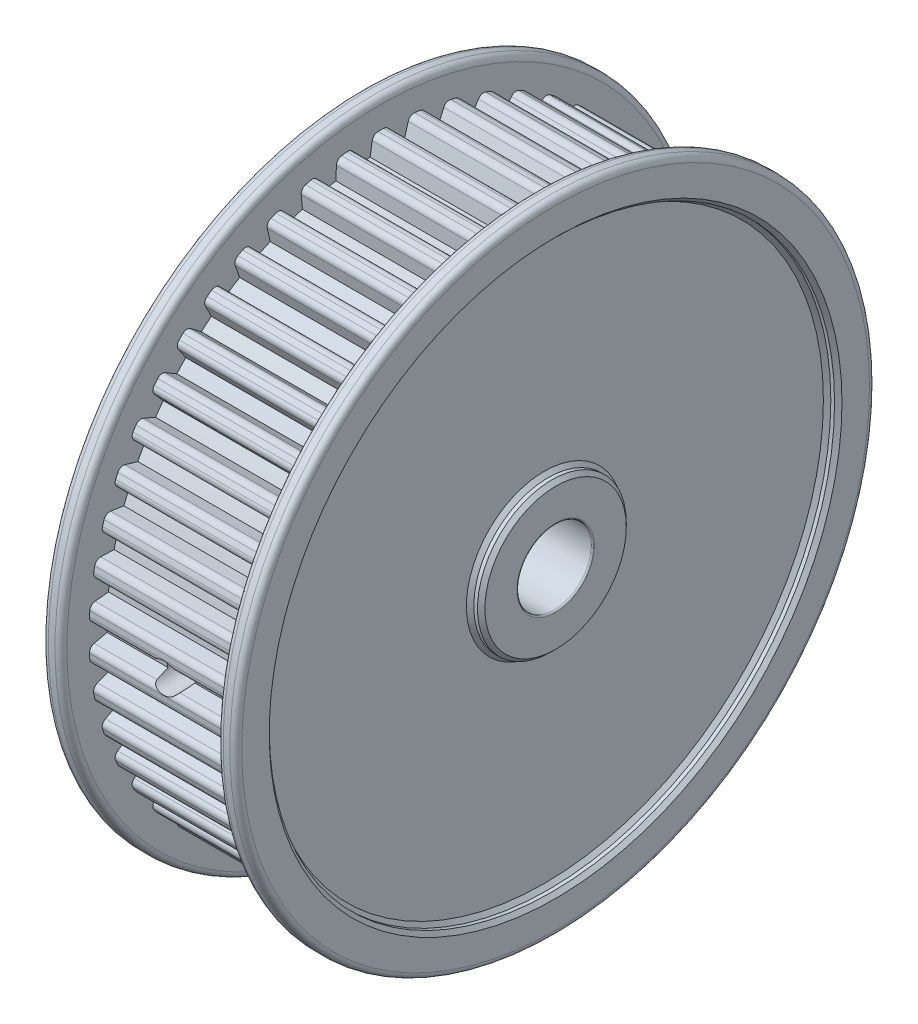
from build123d import *

# Parameters (mm, degrees)
SKETCH_1_R               = 43
EXTRUDE_1_DEPTH          = 2.5
EXTRUDE_2_DEPTH          = 21
SKETCH_3_R               = 43
EXTRUDE_3_DEPTH          = 2.5
SKETCH_4_R               = 5
CUT_EXTRUDE_1_DEPTH      = 67.136223055
SKETCH_5_R               = 38
SKETCH_5_R_2             = 10
CUT_EXTRUDE_2_DEPTH      = 1.5
CUT_EXTRUDE_START        = -1.5
SKETCH_6_R               = 38
SKETCH_6_R_2             = 10
CUT_EXTRUDE_3_DEPTH      = 1.5
FILLET_1_R               = 0.8
CHAMFER_1_SIZE           = 0.5
CHAMFER_2_SIZE           = 0.5
FILLET_2_R               = 0.2
CUT_EXTRUDE_4_DEPTH      = 67.136223185
CUT_EXTRUDE_4_DEPTH_BACK = 67.136223185
SKETCH_7_R               = 2


with BuildPart() as part:
    # 草图1 → 凸台-拉伸1 (new body)
    with BuildSketch(Plane(origin=(0, 0, 0), x_dir=(0, 0, -1), z_dir=(1, 0, 0))):
        Circle(SKETCH_1_R)
    extrude(amount=EXTRUDE_1_DEPTH)

    # 草图2 → 凸台-拉伸2 (add)
    with BuildSketch(Plane(origin=(2.5, 0, 0), x_dir=(0, 0, -1), z_dir=(1, 0, 0))):
        with BuildLine():
            Line((1.14758971, 38.545549929), (1.433241246, 36.772079347))
            ThreePointArc((1.433241246, 36.772079347), (2.310691119, 36.727383606), (3.186823898, 36.661753278))
            Line((3.186823898, 36.661753278), (3.69249779, 38.385437884))
            ThreePointArc((3.69249779, 38.385437884), (4.018691974, 38.827406571), (4.553017122, 38.954825569))
            ThreePointArc((4.553017122, 38.954825569), (4.91556942, 38.910738586), (5.277695458, 38.863277405))
            ThreePointArc((5.277695458, 38.863277405), (5.763545983, 38.606980248), (5.969579034, 38.097775626))
            Line((5.969579034, 38.097775626), (6.030703321, 36.302487759))
            ThreePointArc((6.030703321, 36.302487759), (6.895632377, 36.148170827), (7.756630927, 35.973249459))
            Line((7.756630927, 35.973249459), (8.474352394, 37.619964553))
            ThreePointArc((8.474352394, 37.619964553), (8.853367804, 38.017565213), (9.399449474, 38.077010775))
            ThreePointArc((9.399449474, 38.077010775), (9.753617375, 37.987831579), (10.106939477, 37.895358217))
            ThreePointArc((10.106939477, 37.895358217), (10.556836374, 37.580188823), (10.697424531, 37.049176642))
            Line((10.697424531, 37.049176642), (10.533057601, 35.260384252))
            ThreePointArc((10.533057601, 35.260384252), (11.371825393, 34.9988798), (12.204111251, 34.717426007))
            Line((12.204111251, 34.717426007), (13.122561398, 36.261201908))
            ThreePointArc((13.122561398, 36.261201908), (13.548420735, 36.608164141), (14.097646892, 36.598698776))
            ThreePointArc((14.097646892, 36.598698776), (14.437844956, 36.465833777), (14.776791023, 36.329806593))
            ThreePointArc((14.776791023, 36.329806593), (15.183639149, 35.96073537), (15.256565253, 35.416290011))
            Line((15.256565253, 35.416290011), (14.869299271, 33.662203422))
            ThreePointArc((14.869299271, 33.662203422), (15.66867793, 33.297635531), (16.459125452, 32.914088008))
            Line((16.459125452, 32.914088008), (17.56381977, 34.330578448))
            ThreePointArc((17.56381977, 34.330578448), (18.029806977, 34.621430452), (18.573515998, 34.543203434))
            ThreePointArc((18.573515998, 34.543203434), (18.894379098, 34.368747991), (19.213603747, 34.191312216))
            ThreePointArc((19.213603747, 34.191312216), (19.570986865, 33.774159639), (19.575100827, 33.22486733))
            Line((19.575100827, 33.22486733), (18.971043208, 31.533149535))
            ThreePointArc((18.971043208, 31.533149535), (19.718426055, 31.071267658), (20.454569411, 30.591675178))
            Line((20.454569411, 30.591675178), (21.728086212, 31.858541257))
            ThreePointArc((21.728086212, 31.858541257), (22.226852393, 32.088696123), (22.75646966, 31.942941139))
            ThreePointArc((22.75646966, 31.942941139), (23.052937595, 31.729646519), (23.347406463, 31.513600421))
            ThreePointArc((23.347406463, 31.513600421), (23.649688426, 31.054945235), (23.584925368, 30.509468643))
            Line((23.584925368, 30.509468643), (22.773602462, 28.906799043))
            ThreePointArc((22.773602462, 28.906799043), (23.457202823, 28.354887334), (24.127432592, 27.786813357))
            Line((24.127432592, 27.786813357), (25.549687755, 28.88407584))
            ThreePointArc((25.549687755, 28.88407584), (26.073367069, 29.049903887), (26.580540203, 28.83891958))
            ThreePointArc((26.580540203, 28.83891958), (26.847937495, 28.590149567), (27.113006631, 28.338900321))
            ThreePointArc((27.113006631, 28.338900321), (27.355420274, 27.845975792), (27.222801546, 27.312917411))
            Line((27.222801546, 27.312917411), (26.2170084, 25.824571062))
            ThreePointArc((26.2170084, 25.824571062), (26.826045489, 25.191333498), (27.419791748, 24.543736889))
            Line((27.419791748, 24.543736889), (28.968355459, 25.454091291))
            ThreePointArc((28.968355459, 25.454091291), (29.508689171, 25.552977314), (29.985419747, 25.280091032))
            ThreePointArc((29.985419747, 25.280091032), (30.219529382, 24.999768878), (30.451018488, 24.717278835))
            ThreePointArc((30.451018488, 24.717278835), (30.629740802, 24.197858678), (30.431357882, 23.685625154))
            Line((30.431357882, 23.685625154), (29.246956455, 22.335074168))
            ThreePointArc((29.246956455, 22.335074168), (29.771825393, 21.630497284), (30.279724408, 20.91359103))
            Line((30.279724408, 20.91359103), (31.930174893, 21.622680518))
            ThreePointArc((31.930174893, 21.622680518), (32.478641617, 21.653065023), (32.91741131, 21.322580346))
            ThreePointArc((32.91741131, 21.322580346), (33.114541238, 21.015126899), (33.308799594, 20.705851096))
            ThreePointArc((33.308799594, 20.705851096), (33.421012021, 20.168126876), (33.159993525, 19.68479644))
            Line((33.159993525, 19.68479644), (31.815662535, 18.493339813))
            ThreePointArc((31.815662535, 18.493339813), (32.248085826, 17.728535207), (32.662127726, 16.953625346))
            Line((32.662127726, 16.953625346), (34.388436395, 17.450267156))
            ThreePointArc((34.388436395, 17.450267156), (34.936386483, 17.411670963), (35.330275633, 17.028799832))
            ThreePointArc((35.330275633, 17.028799832), (35.487316998, 16.699063815), (35.641281032, 16.367879717))
            ThreePointArc((35.641281032, 16.367879717), (35.685213915, 15.820331667), (35.365676262, 15.373526727))
            Line((35.365676262, 15.373526727), (33.882616611, 14.359954441))
            ThreePointArc((33.882616611, 14.359954441), (34.215774681, 13.546983539), (34.529429779, 12.726290864))
            Line((34.529429779, 12.726290864), (36.304371711, 13.002652657))
            ThreePointArc((36.304371711, 13.002652657), (36.843163664, 12.895684449), (37.185960403, 12.466464971))
            ThreePointArc((37.185960403, 12.466464971), (37.300436569, 12.119646519), (37.411678177, 11.771777096))
            ThreePointArc((37.411678177, 11.771777096), (37.386638668, 11.223040376), (37.013621157, 10.819807314))
            Line((37.013621157, 10.819807314), (35.415221583, 10.00010401))
            ThreePointArc((35.415221583, 10.00010401), (35.64386033, 9.151787848), (35.852182097, 8.298255172))
            Line((35.852182097, 8.298255172), (37.647765399, 8.349978558))
            ThreePointArc((37.647765399, 8.349978558), (38.168902145, 8.176325289), (38.455200365, 7.70752651))
            ThreePointArc((38.455200365, 7.70752651), (38.525305974, 7.349095158), (38.592070808, 6.990026519))
            ThreePointArc((38.592070808, 6.990026519), (38.498453796, 6.448755034), (38.077839136, 6.095453076))
            Line((38.077839136, 6.095453076), (36.389307355, 5.482545965))
            ThreePointArc((36.389307355, 5.482545965), (36.509821008, 4.612262995), (36.609524086, 3.739351039))
            Line((36.609524086, 3.739351039), (38.397431337, 3.565620309))
            ThreePointArc((38.397431337, 3.565620309), (38.892694238, 3.328020595), (39.117978844, 2.827035753))
            ThreePointArc((39.117978844, 2.827035753), (39.142608289, 2.462644176), (39.163843429, 2.098039048))
            ThreePointArc((39.163843429, 2.098039048), (39.00312531, 1.572768973), (38.541546845, 1.274969902))
            Line((38.541546845, 1.274969902), (36.789512011, 0.878524894))
            ThreePointArc((36.789512011, 0.878524894), (36.8, 0), (36.789512011, -0.878524894))
            Line((36.789512011, -0.878524894), (38.541546845, -1.274969902))
            ThreePointArc((38.541546845, -1.274969902), (39.00312531, -1.572768973), (39.163843429, -2.098039048))
            ThreePointArc((39.163843429, -2.098039048), (39.142608289, -2.462644176), (39.117978844, -2.827035753))
            ThreePointArc((39.117978844, -2.827035753), (38.892694238, -3.328020595), (38.397431337, -3.565620309))
            Line((38.397431337, -3.565620309), (36.609524086, -3.739351039))
            ThreePointArc((36.609524086, -3.739351039), (36.509821008, -4.612262995), (36.389307355, -5.482545965))
            Line((36.389307355, -5.482545965), (38.077839136, -6.095453076))
            ThreePointArc((38.077839136, -6.095453076), (38.498453796, -6.448755034), (38.592070808, -6.990026519))
            ThreePointArc((38.592070808, -6.990026519), (38.525305974, -7.349095158), (38.455200365, -7.70752651))
            ThreePointArc((38.455200365, -7.70752651), (38.168902145, -8.176325289), (37.647765399, -8.349978558))
            Line((37.647765399, -8.349978558), (35.852182097, -8.298255172))
            ThreePointArc((35.852182097, -8.298255172), (35.64386033, -9.151787848), (35.415221583, -10.00010401))
            Line((35.415221583, -10.00010401), (37.013621157, -10.819807314))
            ThreePointArc((37.013621157, -10.819807314), (37.386638668, -11.223040376), (37.411678177, -11.771777096))
            ThreePointArc((37.411678177, -11.771777096), (37.300436569, -12.119646519), (37.185960403, -12.466464971))
            ThreePointArc((37.185960403, -12.466464971), (36.843163664, -12.895684449), (36.304371711, -13.002652657))
            Line((36.304371711, -13.002652657), (34.529429779, -12.726290864))
            ThreePointArc((34.529429779, -12.726290864), (34.215774681, -13.546983539), (33.882616611, -14.359954441))
            Line((33.882616611, -14.359954441), (35.365676262, -15.373526727))
            ThreePointArc((35.365676262, -15.373526727), (35.685213915, -15.820331667), (35.641281032, -16.367879717))
            ThreePointArc((35.641281032, -16.367879717), (35.487316998, -16.699063815), (35.330275633, -17.028799832))
            ThreePointArc((35.330275633, -17.028799832), (34.936386483, -17.411670963), (34.388436395, -17.450267156))
            Line((34.388436395, -17.450267156), (32.662127726, -16.953625346))
            ThreePointArc((32.662127726, -16.953625346), (32.248085826, -17.728535207), (31.815662535, -18.493339813))
            Line((31.815662535, -18.493339813), (33.159993525, -19.68479644))
            ThreePointArc((33.159993525, -19.68479644), (33.421012021, -20.168126876), (33.308799594, -20.705851096))
            ThreePointArc((33.308799594, -20.705851096), (33.114541238, -21.015126899), (32.91741131, -21.322580346))
            ThreePointArc((32.91741131, -21.322580346), (32.478641617, -21.653065023), (31.930174893, -21.622680518))
            Line((31.930174893, -21.622680518), (30.279724408, -20.91359103))
            ThreePointArc((30.279724408, -20.91359103), (29.771825393, -21.630497284), (29.246956455, -22.335074168))
            Line((29.246956455, -22.335074168), (30.431357882, -23.685625154))
            ThreePointArc((30.431357882, -23.685625154), (30.629740802, -24.197858678), (30.451018488, -24.717278835))
            ThreePointArc((30.451018488, -24.717278835), (30.219529382, -24.999768878), (29.985419747, -25.280091032))
            ThreePointArc((29.985419747, -25.280091032), (29.508689171, -25.552977314), (28.968355459, -25.454091291))
            Line((28.968355459, -25.454091291), (27.419791748, -24.543736889))
            ThreePointArc((27.419791748, -24.543736889), (26.826045489, -25.191333498), (26.2170084, -25.824571062))
            Line((26.2170084, -25.824571062), (27.222801546, -27.312917411))
            ThreePointArc((27.222801546, -27.312917411), (27.355420274, -27.845975792), (27.113006631, -28.338900321))
            ThreePointArc((27.113006631, -28.338900321), (26.847937495, -28.590149567), (26.580540203, -28.83891958))
            ThreePointArc((26.580540203, -28.83891958), (26.073367069, -29.049903887), (25.549687755, -28.88407584))
            Line((25.549687755, -28.88407584), (24.127432592, -27.786813357))
            ThreePointArc((24.127432592, -27.786813357), (23.457202823, -28.354887334), (22.773602462, -28.906799043))
            Line((22.773602462, -28.906799043), (23.584925368, -30.509468643))
            ThreePointArc((23.584925368, -30.509468643), (23.649688426, -31.054945235), (23.347406463, -31.513600421))
            ThreePointArc((23.347406463, -31.513600421), (23.052937595, -31.729646519), (22.75646966, -31.942941139))
            ThreePointArc((22.75646966, -31.942941139), (22.226852393, -32.088696123), (21.728086212, -31.858541257))
            Line((21.728086212, -31.858541257), (20.454569411, -30.591675178))
            ThreePointArc((20.454569411, -30.591675178), (19.718426055, -31.071267658), (18.971043208, -31.533149535))
            Line((18.971043208, -31.533149535), (19.575100827, -33.22486733))
            ThreePointArc((19.575100827, -33.22486733), (19.570986865, -33.774159639), (19.213603747, -34.191312216))
            ThreePointArc((19.213603747, -34.191312216), (18.894379098, -34.368747991), (18.573515998, -34.543203434))
            ThreePointArc((18.573515998, -34.543203434), (18.029806977, -34.621430452), (17.56381977, -34.330578448))
            Line((17.56381977, -34.330578448), (16.459125452, -32.914088008))
            ThreePointArc((16.459125452, -32.914088008), (15.66867793, -33.297635531), (14.869299271, -33.662203422))
            Line((14.869299271, -33.662203422), (15.256565253, -35.416290011))
            ThreePointArc((15.256565253, -35.416290011), (15.183639149, -35.96073537), (14.776791023, -36.329806593))
            ThreePointArc((14.776791023, -36.329806593), (14.437844956, -36.465833777), (14.097646892, -36.598698776))
            ThreePointArc((14.097646892, -36.598698776), (13.548420735, -36.608164141), (13.122561398, -36.261201908))
            Line((13.122561398, -36.261201908), (12.204111251, -34.717426007))
            ThreePointArc((12.204111251, -34.717426007), (11.371825393, -34.9988798), (10.533057601, -35.260384252))
            Line((10.533057601, -35.260384252), (10.697424531, -37.049176642))
            ThreePointArc((10.697424531, -37.049176642), (10.556836374, -37.580188823), (10.106939477, -37.895358217))
            ThreePointArc((10.106939477, -37.895358217), (9.753617375, -37.987831579), (9.399449474, -38.077010775))
            ThreePointArc((9.399449474, -38.077010775), (8.853367804, -38.017565213), (8.474352394, -37.619964553))
            Line((8.474352394, -37.619964553), (7.756630927, -35.973249459))
            ThreePointArc((7.756630927, -35.973249459), (6.895632377, -36.148170827), (6.030703321, -36.302487759))
            Line((6.030703321, -36.302487759), (5.969579034, -38.097775626))
            ThreePointArc((5.969579034, -38.097775626), (5.763545983, -38.606980248), (5.277695458, -38.863277405))
            ThreePointArc((5.277695458, -38.863277405), (4.91556942, -38.910738586), (4.553017122, -38.954825569))
            ThreePointArc((4.553017122, -38.954825569), (4.018691974, -38.827406571), (3.69249779, -38.385437884))
            Line((3.69249779, -38.385437884), (3.186823898, -36.661753278))
            ThreePointArc((3.186823898, -36.661753278), (2.310691119, -36.727383606), (1.433241246, -36.772079347))
            Line((1.433241246, -36.772079347), (1.14758971, -38.545549929))
            ThreePointArc((1.14758971, -38.545549929), (0.879361029, -39.024916532), (0.365219029, -39.218299492))
            ThreePointArc((0.365219029, -39.218299492), (0, -39.22), (-0.365219029, -39.218299492))
            ThreePointArc((-0.365219029, -39.218299492), (-0.879361029, -39.024916532), (-1.14758971, -38.545549929))
            Line((-1.14758971, -38.545549929), (-1.433241246, -36.772079347))
            ThreePointArc((-1.433241246, -36.772079347), (-2.310691119, -36.727383606), (-3.186823898, -36.661753278))
            Line((-3.186823898, -36.661753278), (-3.69249779, -38.385437884))
            ThreePointArc((-3.69249779, -38.385437884), (-4.018691974, -38.827406571), (-4.553017122, -38.954825569))
            ThreePointArc((-4.553017122, -38.954825569), (-4.91556942, -38.910738586), (-5.277695458, -38.863277405))
            ThreePointArc((-5.277695458, -38.863277405), (-5.763545983, -38.606980248), (-5.969579034, -38.097775626))
            Line((-5.969579034, -38.097775626), (-6.030703321, -36.302487759))
            ThreePointArc((-6.030703321, -36.302487759), (-6.895632377, -36.148170827), (-7.756630927, -35.973249459))
            Line((-7.756630927, -35.973249459), (-8.474352394, -37.619964553))
            ThreePointArc((-8.474352394, -37.619964553), (-8.853367804, -38.017565213), (-9.399449474, -38.077010775))
            ThreePointArc((-9.399449474, -38.077010775), (-9.753617375, -37.987831579), (-10.106939477, -37.895358217))
            ThreePointArc((-10.106939477, -37.895358217), (-10.556836374, -37.580188823), (-10.697424531, -37.049176642))
            Line((-10.697424531, -37.049176642), (-10.533057601, -35.260384252))
            ThreePointArc((-10.533057601, -35.260384252), (-11.371825393, -34.9988798), (-12.204111251, -34.717426007))
            Line((-12.204111251, -34.717426007), (-13.122561398, -36.261201908))
            ThreePointArc((-13.122561398, -36.261201908), (-13.548420735, -36.608164141), (-14.097646892, -36.598698776))
            ThreePointArc((-14.097646892, -36.598698776), (-14.437844956, -36.465833777), (-14.776791023, -36.329806593))
            ThreePointArc((-14.776791023, -36.329806593), (-15.183639149, -35.96073537), (-15.256565253, -35.416290011))
            Line((-15.256565253, -35.416290011), (-14.869299271, -33.662203422))
            ThreePointArc((-14.869299271, -33.662203422), (-15.66867793, -33.297635531), (-16.459125452, -32.914088008))
            Line((-16.459125452, -32.914088008), (-17.56381977, -34.330578448))
            ThreePointArc((-17.56381977, -34.330578448), (-18.029806977, -34.621430452), (-18.573515998, -34.543203434))
            ThreePointArc((-18.573515998, -34.543203434), (-18.894379098, -34.368747991), (-19.213603747, -34.191312216))
            ThreePointArc((-19.213603747, -34.191312216), (-19.570986865, -33.774159639), (-19.575100827, -33.22486733))
            Line((-19.575100827, -33.22486733), (-18.971043208, -31.533149535))
            ThreePointArc((-18.971043208, -31.533149535), (-19.718426055, -31.071267658), (-20.454569411, -30.591675178))
            Line((-20.454569411, -30.591675178), (-21.728086212, -31.858541257))
            ThreePointArc((-21.728086212, -31.858541257), (-22.226852393, -32.088696123), (-22.75646966, -31.942941139))
            ThreePointArc((-22.75646966, -31.942941139), (-23.052937595, -31.729646519), (-23.347406463, -31.513600421))
            ThreePointArc((-23.347406463, -31.513600421), (-23.649688426, -31.054945235), (-23.584925368, -30.509468643))
            Line((-23.584925368, -30.509468643), (-22.773602462, -28.906799043))
            ThreePointArc((-22.773602462, -28.906799043), (-23.457202823, -28.354887334), (-24.127432592, -27.786813357))
            Line((-24.127432592, -27.786813357), (-25.549687755, -28.88407584))
            ThreePointArc((-25.549687755, -28.88407584), (-26.073367069, -29.049903887), (-26.580540203, -28.83891958))
            ThreePointArc((-26.580540203, -28.83891958), (-26.847937495, -28.590149567), (-27.113006631, -28.338900321))
            ThreePointArc((-27.113006631, -28.338900321), (-27.355420274, -27.845975792), (-27.222801546, -27.312917411))
            Line((-27.222801546, -27.312917411), (-26.2170084, -25.824571062))
            ThreePointArc((-26.2170084, -25.824571062), (-26.826045489, -25.191333498), (-27.419791748, -24.543736889))
            Line((-27.419791748, -24.543736889), (-28.968355459, -25.454091291))
            ThreePointArc((-28.968355459, -25.454091291), (-29.508689171, -25.552977314), (-29.985419747, -25.280091032))
            ThreePointArc((-29.985419747, -25.280091032), (-30.219529382, -24.999768878), (-30.451018488, -24.717278835))
            ThreePointArc((-30.451018488, -24.717278835), (-30.629740802, -24.197858678), (-30.431357882, -23.685625154))
            Line((-30.431357882, -23.685625154), (-29.246956455, -22.335074168))
            ThreePointArc((-29.246956455, -22.335074168), (-29.771825393, -21.630497284), (-30.279724408, -20.91359103))
            Line((-30.279724408, -20.91359103), (-31.930174893, -21.622680518))
            ThreePointArc((-31.930174893, -21.622680518), (-32.478641617, -21.653065023), (-32.91741131, -21.322580346))
            ThreePointArc((-32.91741131, -21.322580346), (-33.114541238, -21.015126899), (-33.308799594, -20.705851096))
            ThreePointArc((-33.308799594, -20.705851096), (-33.421012021, -20.168126876), (-33.159993525, -19.68479644))
            Line((-33.159993525, -19.68479644), (-31.815662535, -18.493339813))
            ThreePointArc((-31.815662535, -18.493339813), (-32.248085826, -17.728535207), (-32.662127726, -16.953625346))
            Line((-32.662127726, -16.953625346), (-34.388436395, -17.450267156))
            ThreePointArc((-34.388436395, -17.450267156), (-34.936386483, -17.411670963), (-35.330275633, -17.028799832))
            ThreePointArc((-35.330275633, -17.028799832), (-35.487316998, -16.699063815), (-35.641281032, -16.367879717))
            ThreePointArc((-35.641281032, -16.367879717), (-35.685213915, -15.820331667), (-35.365676262, -15.373526727))
            Line((-35.365676262, -15.373526727), (-33.882616611, -14.359954441))
            ThreePointArc((-33.882616611, -14.359954441), (-34.215774681, -13.546983539), (-34.529429779, -12.726290864))
            Line((-34.529429779, -12.726290864), (-36.304371711, -13.002652657))
            ThreePointArc((-36.304371711, -13.002652657), (-36.843163664, -12.895684449), (-37.185960403, -12.466464971))
            ThreePointArc((-37.185960403, -12.466464971), (-37.300436569, -12.119646519), (-37.411678177, -11.771777096))
            ThreePointArc((-37.411678177, -11.771777096), (-37.386638668, -11.223040376), (-37.013621157, -10.819807314))
            Line((-37.013621157, -10.819807314), (-35.415221583, -10.00010401))
            ThreePointArc((-35.415221583, -10.00010401), (-35.64386033, -9.151787848), (-35.852182097, -8.298255172))
            Line((-35.852182097, -8.298255172), (-37.647765399, -8.349978558))
            ThreePointArc((-37.647765399, -8.349978558), (-38.168902145, -8.176325289), (-38.455200365, -7.70752651))
            ThreePointArc((-38.455200365, -7.70752651), (-38.525305974, -7.349095158), (-38.592070808, -6.990026519))
            ThreePointArc((-38.592070808, -6.990026519), (-38.498453796, -6.448755034), (-38.077839136, -6.095453076))
            Line((-38.077839136, -6.095453076), (-36.389307355, -5.482545965))
            ThreePointArc((-36.389307355, -5.482545965), (-36.509821008, -4.612262995), (-36.609524086, -3.739351039))
            Line((-36.609524086, -3.739351039), (-38.397431337, -3.565620309))
            ThreePointArc((-38.397431337, -3.565620309), (-38.892694238, -3.328020595), (-39.117978844, -2.827035753))
            ThreePointArc((-39.117978844, -2.827035753), (-39.142608289, -2.462644176), (-39.163843429, -2.098039048))
            ThreePointArc((-39.163843429, -2.098039048), (-39.00312531, -1.572768973), (-38.541546845, -1.274969902))
            Line((-38.541546845, -1.274969902), (-36.789512011, -0.878524894))
            ThreePointArc((-36.789512011, -0.878524894), (-36.8, 0), (-36.789512011, 0.878524894))
            Line((-36.789512011, 0.878524894), (-38.541546845, 1.274969902))
            ThreePointArc((-38.541546845, 1.274969902), (-39.00312531, 1.572768973), (-39.163843429, 2.098039048))
            ThreePointArc((-39.163843429, 2.098039048), (-39.142608289, 2.462644176), (-39.117978844, 2.827035753))
            ThreePointArc((-39.117978844, 2.827035753), (-38.892694238, 3.328020595), (-38.397431337, 3.565620309))
            Line((-38.397431337, 3.565620309), (-36.609524086, 3.739351039))
            ThreePointArc((-36.609524086, 3.739351039), (-36.509821008, 4.612262995), (-36.389307355, 5.482545965))
            Line((-36.389307355, 5.482545965), (-38.077839136, 6.095453076))
            ThreePointArc((-38.077839136, 6.095453076), (-38.498453796, 6.448755034), (-38.592070808, 6.990026519))
            ThreePointArc((-38.592070808, 6.990026519), (-38.525305974, 7.349095158), (-38.455200365, 7.70752651))
            ThreePointArc((-38.455200365, 7.70752651), (-38.168902145, 8.176325289), (-37.647765399, 8.349978558))
            Line((-37.647765399, 8.349978558), (-35.852182097, 8.298255172))
            ThreePointArc((-35.852182097, 8.298255172), (-35.64386033, 9.151787848), (-35.415221583, 10.00010401))
            Line((-35.415221583, 10.00010401), (-37.013621157, 10.819807314))
            ThreePointArc((-37.013621157, 10.819807314), (-37.386638668, 11.223040376), (-37.411678177, 11.771777096))
            ThreePointArc((-37.411678177, 11.771777096), (-37.300436569, 12.119646519), (-37.185960403, 12.466464971))
            ThreePointArc((-37.185960403, 12.466464971), (-36.843163664, 12.895684449), (-36.304371711, 13.002652657))
            Line((-36.304371711, 13.002652657), (-34.529429779, 12.726290864))
            ThreePointArc((-34.529429779, 12.726290864), (-34.215774681, 13.546983539), (-33.882616611, 14.359954441))
            Line((-33.882616611, 14.359954441), (-35.365676262, 15.373526727))
            ThreePointArc((-35.365676262, 15.373526727), (-35.685213915, 15.820331667), (-35.641281032, 16.367879717))
            ThreePointArc((-35.641281032, 16.367879717), (-35.487316998, 16.699063815), (-35.330275633, 17.028799832))
            ThreePointArc((-35.330275633, 17.028799832), (-34.936386483, 17.411670963), (-34.388436395, 17.450267156))
            Line((-34.388436395, 17.450267156), (-32.662127726, 16.953625346))
            ThreePointArc((-32.662127726, 16.953625346), (-32.248085826, 17.728535207), (-31.815662535, 18.493339813))
            Line((-31.815662535, 18.493339813), (-33.159993525, 19.68479644))
            ThreePointArc((-33.159993525, 19.68479644), (-33.421012021, 20.168126876), (-33.308799594, 20.705851096))
            ThreePointArc((-33.308799594, 20.705851096), (-33.114541238, 21.015126899), (-32.91741131, 21.322580346))
            ThreePointArc((-32.91741131, 21.322580346), (-32.478641617, 21.653065023), (-31.930174893, 21.622680518))
            Line((-31.930174893, 21.622680518), (-30.279724408, 20.91359103))
            ThreePointArc((-30.279724408, 20.91359103), (-29.771825393, 21.630497284), (-29.246956455, 22.335074168))
            Line((-29.246956455, 22.335074168), (-30.431357882, 23.685625154))
            ThreePointArc((-30.431357882, 23.685625154), (-30.629740802, 24.197858678), (-30.451018488, 24.717278835))
            ThreePointArc((-30.451018488, 24.717278835), (-30.219529382, 24.999768878), (-29.985419747, 25.280091032))
            ThreePointArc((-29.985419747, 25.280091032), (-29.508689171, 25.552977314), (-28.968355459, 25.454091291))
            Line((-28.968355459, 25.454091291), (-27.419791748, 24.543736889))
            ThreePointArc((-27.419791748, 24.543736889), (-26.826045489, 25.191333498), (-26.2170084, 25.824571062))
            Line((-26.2170084, 25.824571062), (-27.222801546, 27.312917411))
            ThreePointArc((-27.222801546, 27.312917411), (-27.355420274, 27.845975792), (-27.113006631, 28.338900321))
            ThreePointArc((-27.113006631, 28.338900321), (-26.847937495, 28.590149567), (-26.580540203, 28.83891958))
            ThreePointArc((-26.580540203, 28.83891958), (-26.073367069, 29.049903887), (-25.549687755, 28.88407584))
            Line((-25.549687755, 28.88407584), (-24.127432592, 27.786813357))
            ThreePointArc((-24.127432592, 27.786813357), (-23.457202823, 28.354887334), (-22.773602462, 28.906799043))
            Line((-22.773602462, 28.906799043), (-23.584925368, 30.509468643))
            ThreePointArc((-23.584925368, 30.509468643), (-23.649688426, 31.054945235), (-23.347406463, 31.513600421))
            ThreePointArc((-23.347406463, 31.513600421), (-23.052937595, 31.729646519), (-22.75646966, 31.942941139))
            ThreePointArc((-22.75646966, 31.942941139), (-22.226852393, 32.088696123), (-21.728086212, 31.858541257))
            Line((-21.728086212, 31.858541257), (-20.454569411, 30.591675178))
            ThreePointArc((-20.454569411, 30.591675178), (-19.718426055, 31.071267658), (-18.971043208, 31.533149535))
            Line((-18.971043208, 31.533149535), (-19.575100827, 33.22486733))
            ThreePointArc((-19.575100827, 33.22486733), (-19.570986865, 33.774159639), (-19.213603747, 34.191312216))
            ThreePointArc((-19.213603747, 34.191312216), (-18.894379098, 34.368747991), (-18.573515998, 34.543203434))
            ThreePointArc((-18.573515998, 34.543203434), (-18.029806977, 34.621430452), (-17.56381977, 34.330578448))
            Line((-17.56381977, 34.330578448), (-16.459125452, 32.914088008))
            ThreePointArc((-16.459125452, 32.914088008), (-15.66867793, 33.297635531), (-14.869299271, 33.662203422))
            Line((-14.869299271, 33.662203422), (-15.256565253, 35.416290011))
            ThreePointArc((-15.256565253, 35.416290011), (-15.183639149, 35.96073537), (-14.776791023, 36.329806593))
            ThreePointArc((-14.776791023, 36.329806593), (-14.437844956, 36.465833777), (-14.097646892, 36.598698776))
            ThreePointArc((-14.097646892, 36.598698776), (-13.548420735, 36.608164141), (-13.122561398, 36.261201908))
            Line((-13.122561398, 36.261201908), (-12.204111251, 34.717426007))
            ThreePointArc((-12.204111251, 34.717426007), (-11.371825393, 34.9988798), (-10.533057601, 35.260384252))
            Line((-10.533057601, 35.260384252), (-10.697424531, 37.049176642))
            ThreePointArc((-10.697424531, 37.049176642), (-10.556836374, 37.580188823), (-10.106939477, 37.895358217))
            ThreePointArc((-10.106939477, 37.895358217), (-9.753617375, 37.987831579), (-9.399449474, 38.077010775))
            ThreePointArc((-9.399449474, 38.077010775), (-8.853367804, 38.017565213), (-8.474352394, 37.619964553))
            Line((-8.474352394, 37.619964553), (-7.756630927, 35.973249459))
            ThreePointArc((-7.756630927, 35.973249459), (-6.895632377, 36.148170827), (-6.030703321, 36.302487759))
            Line((-6.030703321, 36.302487759), (-5.969579034, 38.097775626))
            ThreePointArc((-5.969579034, 38.097775626), (-5.763545983, 38.606980248), (-5.277695458, 38.863277405))
            ThreePointArc((-5.277695458, 38.863277405), (-4.91556942, 38.910738586), (-4.553017122, 38.954825569))
            ThreePointArc((-4.553017122, 38.954825569), (-4.018691974, 38.827406571), (-3.69249779, 38.385437884))
            Line((-3.69249779, 38.385437884), (-3.186823898, 36.661753278))
            ThreePointArc((-3.186823898, 36.661753278), (-2.310691119, 36.727383606), (-1.433241246, 36.772079347))
            Line((-1.433241246, 36.772079347), (-1.14758971, 38.545549929))
            ThreePointArc((-1.14758971, 38.545549929), (-0.879361029, 39.024916532), (-0.365219029, 39.218299492))
            ThreePointArc((-0.365219029, 39.218299492), (0, 39.22), (0.365219029, 39.218299492))
            ThreePointArc((0.365219029, 39.218299492), (0.879361029, 39.024916532), (1.14758971, 38.545549929))
        make_face()
    extrude(amount=EXTRUDE_2_DEPTH)

    # 草图3 → 凸台-拉伸3 (add)
    with BuildSketch(Plane(origin=(23.5, 0, 0), x_dir=(0, 0, -1), z_dir=(1, 0, 0))):
        Circle(SKETCH_3_R)
    extrude(amount=EXTRUDE_3_DEPTH)

    # 草图4 → 切除-拉伸1 (cut, through all)
    with BuildSketch(Plane(origin=(26, 0, 0), x_dir=(0, 0, -1), z_dir=(1, 0, 0))):
        Circle(SKETCH_4_R)
    extrude(amount=-CUT_EXTRUDE_1_DEPTH, mode=Mode.SUBTRACT)

    # 草图5 → 切除-拉伸2 (cut)
    with BuildSketch(Plane(origin=(26, 0, 0), x_dir=(0, 0, -1), z_dir=(1, 0, 0))):
        Circle(SKETCH_5_R)
        Circle(SKETCH_5_R_2, mode=Mode.SUBTRACT)
    extrude(amount=-CUT_EXTRUDE_2_DEPTH, mode=Mode.SUBTRACT)

    # 草图6 → 切除-拉伸3 (cut)
    with BuildSketch(Plane.ZY.offset(CUT_EXTRUDE_START)):
        Circle(SKETCH_6_R)
        Circle(SKETCH_6_R_2, mode=Mode.SUBTRACT)
    extrude(amount=CUT_EXTRUDE_3_DEPTH, mode=Mode.SUBTRACT)

    # 圆角1
    fillet_1_edges = [part.edges().sort_by_distance(p)[0] for p in [
        (26, 0, 43),
        (23.5, 0, 43),
        (2.5, 0, 43),
        (0, 0, 43),
    ]]
    fillet(fillet_1_edges, radius=FILLET_1_R)

    # 倒角1
    chamfer_1_edges = [part.edges().sort_by_distance(p)[0] for p in [
        (0, 0, -10),
        (1.5, 0, -10),
        (1.5, 0, -38),
        (0, 0, -38),
    ]]
    chamfer(chamfer_1_edges, length=CHAMFER_1_SIZE)

    # 倒角2
    chamfer_2_edges = [part.edges().sort_by_distance(p)[0] for p in [
        (24.5, 0, 10),
        (26, 0, 10),
        (24.5, 0, 38),
        (26, 0, 38),
    ]]
    chamfer(chamfer_2_edges, length=CHAMFER_2_SIZE)

    # 圆角2
    fillet_2_edges = [part.edges().sort_by_distance(p)[0] for p in [
        (0, 0, 5),
        (26, 0, 5),
    ]]
    fillet(fillet_2_edges, radius=FILLET_2_R)

    # 草图7 → 切除-拉伸4 (cut, two sides: drawn at the far end of the back side and taken through both)
    with BuildSketch(Plane.XY.offset(-CUT_EXTRUDE_4_DEPTH_BACK)):
        with Locations((12.5, 0)):
            Circle(SKETCH_7_R)
    extrude(amount=CUT_EXTRUDE_4_DEPTH + CUT_EXTRUDE_4_DEPTH_BACK, mode=Mode.SUBTRACT)


solid = part.part
